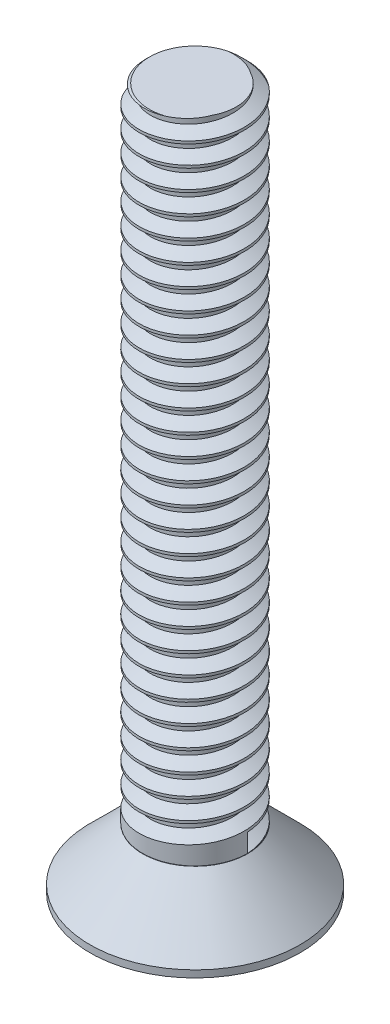
from build123d import *

# Parameters (mm, degrees)
CHAMFER1_SIZE   = 0.2
HEX_DEPTH_DEPTH = 1.2
SKETCH4_R       = 1
SKETCH3_R       = 1.154700538
THREADM3_PITCH  = 0.6


with BuildPart() as part:
    # Sketch1 → Revolve1 (revolve)
    with BuildSketch(Plane.XY, mode=Mode.PRIVATE) as revolve1_sk:
        Polygon((0, 1.926116132), (-3, 1.926116132), (-3, 2.126116132), (-1.5, 3.626116132), (-1.49, 3.626116132), (-1.49, 3.636116132), (-1.5, 3.636116132), (-1.5, 21.926116132), (0, 21.926116132), align=None)
    revolve(revolve1_sk.sketch.rotate(Axis((0, 0, 0), (0, 1, 0)), 270), axis=Axis((0, 0, 0), (0, 1, 0)))

    # Chamfer1
    chamfer1_edges = [part.edges().sort_by_distance(p)[0] for p in [
        (0, 21.926116132, 1.5),
    ]]
    chamfer(chamfer1_edges, length=CHAMFER1_SIZE)

    # Sketch2 → hex depth (cut)
    with BuildSketch(Plane.XZ.offset(-1.926116132)):
        Polygon((1.154700538, 0), (0.577350269, 1), (-0.577350269, 1), (-1.154700538, 0), (-0.577350269, -1), (0.577350269, -1), align=None)
    extrude(amount=-HEX_DEPTH_DEPTH, mode=Mode.SUBTRACT)

    # Sketch4 → hex corner cut section 0
    with BuildSketch(Plane(origin=(0, 2.126116132, 0), x_dir=(1, 0, 0), z_dir=(0, 1, 0))):
        Circle(SKETCH4_R)
    # Sketch3 → hex corner cut section 1
    with BuildSketch(Plane.XZ.offset(-1.926116132)):
        Circle(SKETCH3_R)
    loft(mode=Mode.SUBTRACT)

    # threadM3: arcs per turn and ends read off the stored shape
    # threadM3: the profile of Thread Profile2 profile screwed along a right-hand helix through 32.149997 turns, 6 arcs to a turn; built about Z, then put on its axis
    threadm3_z = Axis((0, 0, 0), (0, 0, 1))
    threadm3_corners = [(1.5003, 0, -0.000173205), (1.5003, 0, 0.525173204), (1.175240475, 0, 0.337499999), (1.175240475, 0, 0.187499999)]
    with BuildLine(mode=Mode.PRIVATE) as threadm3_profile:
        Line(threadm3_corners[0], threadm3_corners[1])
        Line(threadm3_corners[1], threadm3_corners[2])
        Line(threadm3_corners[2], threadm3_corners[3])
        Line(threadm3_corners[3], threadm3_corners[0])
    threadm3_cap = Face(threadm3_profile.wire())
    threadm3_turn_angles = [0, 30, 60, 90, 120, 150, 180, 210, 240, 270, 300, 330, 360]
    threadm3_turn_weights = [1, 0.8660254037844387, 1, 0.8660254037844387, 1, 0.8660254037844387, 1, 0.8660254037844387, 1, 0.8660254037844387, 1, 0.8660254037844387, 1]
    threadm3_turn_rails = [Edge.make_bspline([Vector(p[0], p[1], 0).rotate(threadm3_z, threadm3_turn_angles[k]) / threadm3_turn_weights[k] + Vector(0, 0, p[2] + THREADM3_PITCH * threadm3_turn_angles[k] / 360) for k in range(13)], [0, 0, 0, 1, 1, 2, 2, 3, 3, 4, 4, 5, 5, 6, 6, 6], 2, threadm3_turn_weights) for p in threadm3_corners]
    threadm3_turn_sides = [Face.make_surface_from_curves(threadm3_turn_rails[p[0]], threadm3_turn_rails[p[1]]) for p in [(0, 1), (1, 2), (2, 3), (3, 0)]]
    threadm3_last_angles = [11520, 11546.9995, 11573.999]
    threadm3_last_weights = [1, 0.8910104859689382, 1]
    threadm3_last_rails = [Edge.make_bspline([Vector(p[0], p[1], 0).rotate(threadm3_z, threadm3_last_angles[k]) / threadm3_last_weights[k] + Vector(0, 0, p[2] + THREADM3_PITCH * threadm3_last_angles[k] / 360) for k in range(3)], [0, 0, 0, 1, 1, 1], 2, threadm3_last_weights) for p in threadm3_corners]
    threadm3_last_sides = [Face.make_surface_from_curves(threadm3_last_rails[p[0]], threadm3_last_rails[p[1]]) for p in [(0, 1), (1, 2), (2, 3), (3, 0)]]
    threadm3 = Plane(origin=(0, 3.636116132, 0), x_dir=(1, 0, 0), z_dir=(0, 1, 0)) * Solid(Shell([*[p.moved(Location((0, 0, THREADM3_PITCH * i))) for i in range(32) for p in threadm3_turn_sides], *threadm3_last_sides, threadm3_cap, threadm3_cap.rotate(threadm3_z, 11573.999).moved(Location((0, 0, THREADM3_PITCH * 11573.999 / 360)))]))
    add(threadm3, mode=Mode.SUBTRACT)


solid = part.part
